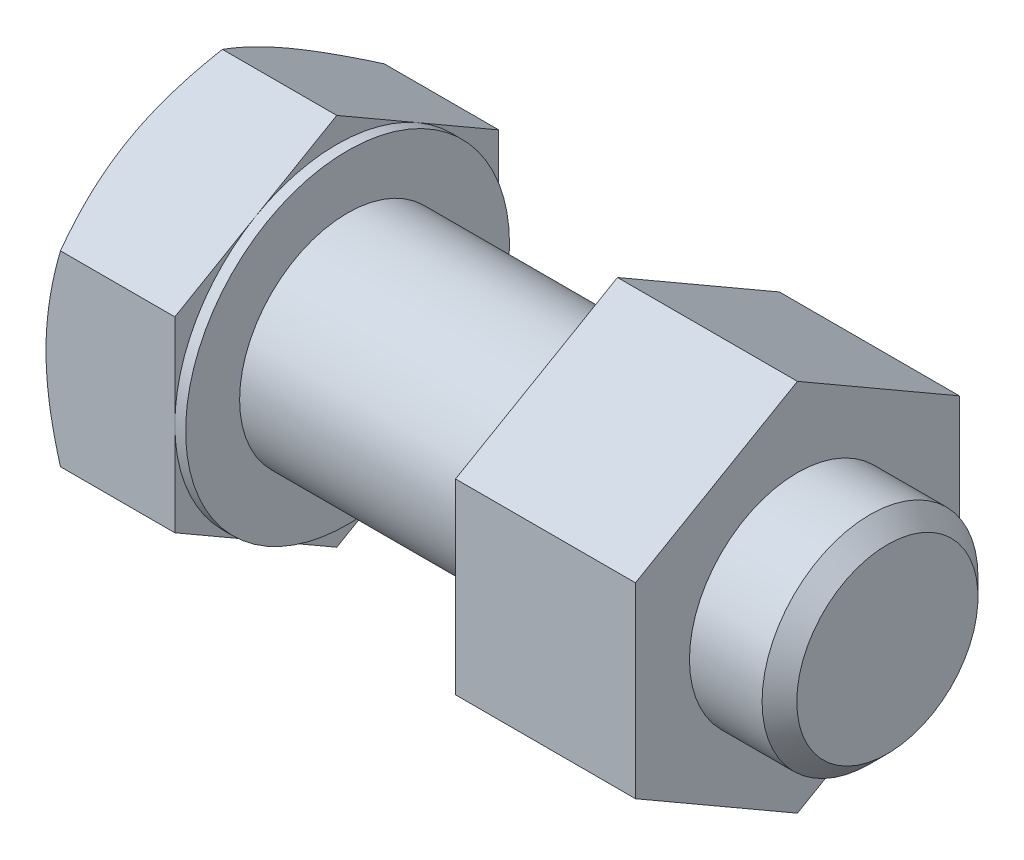
from build123d import *

# Parameters (mm, degrees)
BASEHEAD_DEPTH      = 7.76
SKETCH4_W           = 0.6
SKETCH4_H           = 11.392304845
BOSS_EXTRUDE1_DEPTH = 10


# Read off the part's stored shape, not the designer's step: HeadChamfer
with BuildPart() as part:
    # Sketch1 → BaseHead (new body)
    with BuildSketch(Plane(origin=(0, 0, 0), x_dir=(0, 0, -1), z_dir=(1, 0, 0))):
        Polygon((9, 5.196152423), (9, -5.196152423), (0, -10.392304845), (-9, -5.196152423), (-9, 5.196152423), (0, 10.392304845), align=None)
    extrude(amount=BASEHEAD_DEPTH)

    # HeadChamfer outline → HeadChamfer (revolve, cut)
    with BuildSketch(Plane.YX):
        Polygon((10.392304847, 0.803847578), (9, 0), (10.392304847, 0), align=None)
    revolve(axis=Axis((0, 0, 0), (1, 0, 0)), mode=Mode.SUBTRACT)

    # HeadChamfer 2 outline → HeadChamfer 2 (revolve)
    with BuildSketch(Plane.YX):
        Polygon((6, 7.76), (6, 36.796), (5.036, 37.76), (0, 37.76), (0, 7.76), align=None)
    revolve(axis=Axis((0, 0, 0), (1, 0, 0)))

    # Sketch4 → BearingFace (revolve, cut)
    with BuildSketch(Plane.XY, mode=Mode.PRIVATE) as bearingface_sk:
        with Locations((7.46, 14.696152423)):
            Rectangle(SKETCH4_W, SKETCH4_H)
    revolve(bearingface_sk.sketch.rotate(Axis((0, 0, 0), (1, 0, 0)), 90), axis=Axis((0, 0, 0), (1, 0, 0)), mode=Mode.SUBTRACT)

    # Sketch5 → Boss-Extrude1 (add)
    with BuildSketch(Plane(origin=(32.76, 0, 0), x_dir=(0, 0, -1), z_dir=(1, 0, 0))):
        Polygon((0, 10.392304845), (-9, 5.196152423), (-9, -5.196152423), (0, -10.392304845), (9, -5.196152423), (9, 5.196152423), align=None)
    extrude(amount=-BOSS_EXTRUDE1_DEPTH)


solid = part.part
